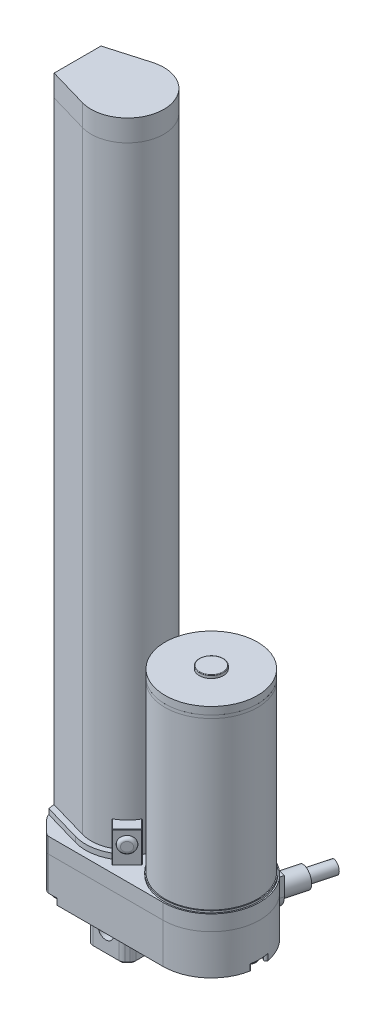
from build123d import *

# Parameters (mm, degrees)
BOSS_EXTRUDE1_DEPTH      = 6.35
SKETCH6_R                = 19.431
BOSS_EXTRUDE4_DEPTH      = 0.762
SKETCH7_R                = 19.05
BOSS_EXTRUDE5_DEPTH      = 68.326
FILLET6_R                = 5.08
FILLET7_R                = 1.905
BOSS_EXTRUDE15_DEPTH     = 6.35
SKETCH24_R               = 4.064
BOSS_EXTRUDE16_DEPTH     = 10.16
SKETCH25_R               = 2.54
BOSS_EXTRUDE17_DEPTH     = 10.16
BOSS_EXTRUDE19_DEPTH     = 16.51
FILLET13_R               = 1.905
FILLET14_R               = 5.08
BOSS_EXTRUDE20_DEPTH     = 18.796
CHAMFER1_SIZE            = 2.54
FILLET15_R               = 2.54
CHAMFER2_SIZE            = 0.762
SKETCH27_R               = 3.175
CUT_EXTRUDE3_DEPTH       = 19.05
SKETCH28_R               = 19.05
BOSS_EXTRUDE22_DEPTH     = 1.27
SKETCH29_R               = 19.05
BOSS_EXTRUDE24_DEPTH     = 3.048
BOSS_EXTRUDE25_START     = 4.318
SKETCH8_R                = 4.953
BOSS_EXTRUDE25_DEPTH     = 1.27
FILLET16_R               = 0.2286
BOSS_EXTRUDE26_DEPTH     = 254.381
BOSS_EXTRUDE27_DEPTH     = 8.89
SKETCH33_R               = 9.906
BOSS_EXTRUDE28_DEPTH     = 21.336
BOSS_EXTRUDE30_DEPTH     = 2.159
BOSS_EXTRUDE31_DEPTH     = 2.159
BOSS_EXTRUDE33_DEPTH     = 12.7
BOSS_EXTRUDE33_2_DEPTH   = 12.7
FILLET17_R               = 0.2286
FILLET18_R               = 0.2286
SKETCH43_R               = 3.175
BOSS_EXTRUDE34_DEPTH     = 1.27
FILLET19_R               = 1.27
SKETCH44_R               = 3.175
BOSS_EXTRUDE35_DEPTH     = 1.27
FILLET20_R               = 1.27
CUT_EXTRUDE5_START       = -2.54
CUT_EXTRUDE5_DEPTH       = 2.54
CUT_EXTRUDE6_START       = -2.54
CUT_EXTRUDE6_DEPTH       = 2.54
SKETCH47_R               = 2.54
BOSS_EXTRUDE36_DEPTH     = 2.54
BOSS_EXTRUDE36_2_DEPTH   = 2.54
BOSS_EXTRUDE36_3_DEPTH   = 2.54
FILLET22_R               = 1.524
FILLET23_R               = 1.524
SKETCH48_R               = 3.81
BOSS_EXTRUDE37_DEPTH     = 1.524
FILLET24_R               = 1.524
FILLET25_R               = 1.524
SKETCH49_R               = 3.81
CUT_EXTRUDE7_DEPTH       = 2.54
SKETCH50_R               = 3.556
BOSS_EXTRUDE39_DEPTH     = 2.54
CUT_EXTRUDE11_DEPTH      = 305.554552522
CUT_EXTRUDE11_DEPTH_BACK = 305.554552522
SKETCH52_R               = 3.175
SKETCH54_R               = 9.906
CUT_EXTRUDE12_DEPTH      = 21.336


with BuildPart() as part:
    # Sketch1 → Boss-Extrude1 (new body)
    with BuildSketch(Plane(origin=(0, 0, 0), x_dir=(1, 0, 0), z_dir=(0, 1, 0))):
        with BuildLine():
            Line((0, 32.639), (7.239, 39.878))
            Line((7.239, 39.878), (55.118, 39.878))
            ThreePointArc((55.118, 39.878), (75.057, 19.939), (55.118, 0))
            Line((55.118, 0), (7.239, 0))
            Line((7.239, 0), (0, 7.239))
            Line((0, 7.239), (0, 32.639))
        make_face()
    extrude(amount=BOSS_EXTRUDE1_DEPTH)

    # Fillet6
    fillet6_edges = [part.edges().sort_by_distance(p)[0] for p in [
        (0, 3.175, -7.239),
        (0, 3.175, -32.639),
    ]]
    fillet(fillet6_edges, radius=FILLET6_R)

    # Fillet7
    fillet7_edges = [part.edges().sort_by_distance(p)[0] for p in [
        (7.239, 3.175, 0),
        (7.239, 3.175, -39.878),
    ]]
    fillet(fillet7_edges, radius=FILLET7_R)


with BuildPart() as body_2:
    # Sketch6 → Boss-Extrude4 (new body)
    with BuildSketch(Plane(origin=(0, 6.35, 0), x_dir=(1, 0, 0), z_dir=(0, 1, 0))):
        with Locations(Location((55.118, 19.939, 0), (0, 0, 90))):
            Circle(SKETCH6_R)
    extrude(amount=BOSS_EXTRUDE4_DEPTH)


with BuildPart() as body_3:
    # Sketch7 → Boss-Extrude5 (new body)
    with BuildSketch(Plane(origin=(0, 7.112, 0), x_dir=(1, 0, 0), z_dir=(0, 1, 0))):
        with Locations(Location((55.118, 19.939, 0), (0, 0, 270))):
            Circle(SKETCH7_R)
    extrude(amount=BOSS_EXTRUDE5_DEPTH)


with BuildPart() as body_4:
    # Sketch23 → Boss-Extrude15 (new body)
    with BuildSketch(Plane(origin=(12.522748088, 0, -46.735532116), x_dir=(0, -1, 0), z_dir=(0.25881904510252135, 0, -0.9659258262890681))):
        with BuildLine():
            Line((-2.032, -53.883866243), (5.588, -53.883866243))
            ThreePointArc((5.588, -53.883866243), (11.303, -48.168866243), (5.588, -42.453866243))
            Line((5.588, -42.453866243), (-2.032, -42.453866243))
            Line((-2.032, -42.453866243), (-2.032, -53.883866243))
        make_face()
    extrude(amount=BOSS_EXTRUDE15_DEPTH)

    # Sketch24 → Boss-Extrude16 (add)
    with BuildSketch(Plane(origin=(14.166249025, 0, -52.869161113), x_dir=(-0.9659258262890682, 0, -0.25881904510252135), z_dir=(0.2588190451025213, 0, -0.9659258262890681))):
        with Locations((-48.168866243, -5.588)):
            Circle(SKETCH24_R)
    extrude(amount=BOSS_EXTRUDE16_DEPTH)

    # Sketch25 → Boss-Extrude17 (add)
    with BuildSketch(Plane(origin=(16.795850523, 0, -62.682967508), x_dir=(-0.9659258262890681, 0, -0.25881904510252135), z_dir=(0.25881904510252135, 0, -0.9659258262890681))):
        with Locations((-48.168866243, -5.588)):
            Circle(SKETCH25_R)
    extrude(amount=BOSS_EXTRUDE17_DEPTH)


with BuildPart() as body_5:
    # Sketch1<3> → Boss-Extrude19 (new body)
    with BuildSketch(Plane(origin=(0, 0, 0), x_dir=(1, 0, 0), z_dir=(0, 1, 0))):
        with BuildLine():
            Line((0, 32.639), (7.239, 39.878))
            Line((7.239, 39.878), (55.118, 39.878))
            ThreePointArc((55.118, 39.878), (75.057, 19.939), (55.118, 0))
            Line((55.118, 0), (7.239, 0))
            Line((7.239, 0), (0, 7.239))
            Line((0, 7.239), (0, 32.639))
        make_face()
    extrude(amount=-BOSS_EXTRUDE19_DEPTH)

    # Fillet13
    fillet13_edges = [body_5.edges().sort_by_distance(p)[0] for p in [
        (7.239, -8.255, 0),
        (7.239, -8.255, -39.878),
    ]]
    fillet(fillet13_edges, radius=FILLET13_R)

    # Fillet14
    fillet14_edges = [body_5.edges().sort_by_distance(p)[0] for p in [
        (0, -8.255, -7.239),
        (0, -8.255, -32.639),
    ]]
    fillet(fillet14_edges, radius=FILLET14_R)

    # Sketch45 → Cut-Extrude5 (cut)
    with BuildSketch(Plane.XZ.offset(16.51).offset(CUT_EXTRUDE5_START)):
        with BuildLine():
            ThreePointArc((5.044290367, -35.978344089), (4.718699387, -36.549691761), (4.084467985, -36.723467985))
            Line((4.084467985, -36.723467985), (6.681038418, -39.320038418))
            ThreePointArc((6.681038418, -39.320038418), (7.299064898, -39.732990509), (8.028076836, -39.878))
            Line((8.028076836, -39.878), (11.393838428, -39.878))
            ThreePointArc((11.393838428, -39.878), (11.138454644, -39.419455597), (11.282110896, -38.914632134))
            ThreePointArc((11.282110896, -38.914632134), (10.476958507, -32.531164357), (5.044290367, -35.978344089))
        make_face()
        with BuildLine():
            ThreePointArc((11.282110896, -0.963367866), (11.138454644, -0.458544403), (11.393838428, 0))
            Line((11.393838428, 0), (8.028076836, 0))
            ThreePointArc((8.028076836, 0), (7.299064898, -0.145009491), (6.681038418, -0.557961582))
            Line((6.681038418, -0.557961582), (4.084467985, -3.154532015))
            ThreePointArc((4.084467985, -3.154532015), (4.718699387, -3.328308239), (5.044290367, -3.899655911))
            ThreePointArc((5.044290367, -3.899655911), (10.476958507, -7.346835643), (11.282110896, -0.963367866))
        make_face()
    extrude(amount=CUT_EXTRUDE5_DEPTH, mode=Mode.SUBTRACT)

    # Sketch45<3> → Cut-Extrude6 (cut)
    with BuildSketch(Plane.XZ.offset(16.51).offset(CUT_EXTRUDE6_START)):
        with BuildLine():
            Line((4.084467985, -36.723467985), (6.681038418, -39.320038418))
            ThreePointArc((6.681038418, -39.320038418), (7.299064898, -39.732990509), (8.028076836, -39.878))
            Line((8.028076836, -39.878), (11.393838428, -39.878))
            ThreePointArc((11.393838428, -39.878), (11.138454644, -39.419455597), (11.282110896, -38.914632134))
            ThreePointArc((11.282110896, -38.914632134), (10.476958507, -32.531164357), (5.044290367, -35.978344089))
            ThreePointArc((5.044290367, -35.978344089), (4.718699387, -36.549691761), (4.084467985, -36.723467985))
        make_face()
        with BuildLine():
            Line((11.393838428, 0), (8.028076836, 0))
            ThreePointArc((8.028076836, 0), (7.299064898, -0.145009491), (6.681038418, -0.557961582))
            Line((6.681038418, -0.557961582), (4.084467985, -3.154532015))
            ThreePointArc((4.084467985, -3.154532015), (4.718699387, -3.328308239), (5.044290367, -3.899655911))
            ThreePointArc((5.044290367, -3.899655911), (10.476958507, -7.346835643), (11.282110896, -0.963367866))
            ThreePointArc((11.282110896, -0.963367866), (11.138454644, -0.458544403), (11.393838428, 0))
        make_face()
        with BuildLine():
            ThreePointArc((73.662109712, -16.992248385), (67.437, -19.939), (73.662109712, -22.885751615))
            ThreePointArc((73.662109712, -22.885751615), (74.341584064, -23.041280193), (74.712069674, -23.631716426))
            ThreePointArc((74.712069674, -23.631716426), (75.057, -19.939), (74.712069674, -16.246283574))
            ThreePointArc((74.712069674, -16.246283574), (74.341584064, -16.836719807), (73.662109712, -16.992248385))
        make_face()
    extrude(amount=CUT_EXTRUDE6_DEPTH, mode=Mode.SUBTRACT)


with BuildPart() as body_6:
    # Sketch26 → Boss-Extrude20 (new body)
    with BuildSketch(Plane(origin=(0, -16.51, 0), x_dir=(-1, 0, 0), z_dir=(0, -1, 0))):
        Polygon((-20.574, 28.829), (-11.684, 28.829), (-11.684, 11.049), (-29.464, 11.049), (-29.464, 28.829), align=None)
    extrude(amount=BOSS_EXTRUDE20_DEPTH)

    # Chamfer1
    chamfer1_edges = [body_6.edges().sort_by_distance(p)[0] for p in [
        (11.684, -25.908, -11.049),
        (29.464, -25.908, -11.049),
        (29.464, -25.908, -28.829),
        (11.684, -25.908, -28.829),
    ]]
    chamfer(chamfer1_edges, length=CHAMFER1_SIZE)

    # Fillet15
    fillet15_edges = [body_6.edges().sort_by_distance(p)[0] for p in [
        (29.464, -25.908, -13.589),
        (29.464, -25.908, -26.289),
        (14.224, -25.908, -28.829),
        (26.924, -25.908, -28.829),
        (14.224, -25.908, -11.049),
        (26.924, -25.908, -11.049),
        (11.684, -25.908, -26.289),
        (11.684, -25.908, -13.589),
    ]]
    fillet(fillet15_edges, radius=FILLET15_R)

    # Chamfer2
    chamfer2_edges = [body_6.edges().sort_by_distance(p)[0] for p in [
        (11.684, -35.306, -19.939),
        (12.954, -35.306, -12.319),
        (20.574, -35.306, -28.829),
        (28.194, -35.306, -27.559),
        (29.464, -35.306, -19.939),
        (28.194, -35.306, -12.319),
        (20.574, -35.306, -11.049),
        (12.954, -35.306, -27.559),
        (14.30408653, -35.306, -28.635654013),
        (11.877345987, -35.306, -26.20891347),
        (26.84391347, -35.306, -28.635654013),
        (29.270654013, -35.306, -26.20891347),
        (29.270654013, -35.306, -13.66908653),
        (26.84391347, -35.306, -11.242345987),
        (14.30408653, -35.306, -11.242345987),
        (11.877345987, -35.306, -13.66908653),
    ]]
    chamfer(chamfer2_edges, length=CHAMFER2_SIZE)

    # Sketch27 → Cut-Extrude3 (cut)
    with BuildSketch(Plane.XY.offset(-11.049)):
        with Locations((20.574, -26.67)):
            Circle(SKETCH27_R)
    extrude(amount=-CUT_EXTRUDE3_DEPTH, mode=Mode.SUBTRACT)


with BuildPart() as body_7:
    # Sketch28 → Boss-Extrude22 (new body)
    with BuildSketch(Plane(origin=(0, 75.438, 0), x_dir=(1, 0, 0), z_dir=(0, 1, 0))):
        with Locations(Location((55.118, 19.939, 0), (0, 0, 270))):
            Circle(SKETCH28_R)
    extrude(amount=BOSS_EXTRUDE22_DEPTH)


with BuildPart() as body_8:
    # Sketch29 → Boss-Extrude24 (new body)
    with BuildSketch(Plane(origin=(0, 76.708, 0), x_dir=(1, 0, 0), z_dir=(0, 1, 0))):
        with Locations(Location((55.118, 19.939, 0), (0, 0, 90))):
            Circle(SKETCH29_R)
    extrude(amount=BOSS_EXTRUDE24_DEPTH)

    # Sketch8 → Boss-Extrude25 (add)
    with BuildSketch(Plane(origin=(0, 75.438, 0), x_dir=(1, 0, 0), z_dir=(0, 1, 0)).offset(BOSS_EXTRUDE25_START)):
        with Locations(Location((55.118, 19.939, 0), (0, 0, 270))):
            Circle(SKETCH8_R)
    extrude(amount=BOSS_EXTRUDE25_DEPTH)

    # Fillet16
    fillet16_edges = [body_8.edges().sort_by_distance(p)[0] for p in [
        (55.118, 81.026, -24.892),
    ]]
    fillet(fillet16_edges, radius=FILLET16_R)


with BuildPart() as body_9:
    # Sketch15 → Boss-Extrude26 (new body)
    with BuildSketch(Plane(origin=(0, 6.35, 0), x_dir=(1, 0, 0), z_dir=(0, 1, 0))):
        with BuildLine():
            Line((0, 19.939), (0, 10.286870396))
            Line((0, 10.286870396), (16.411980417, 5.54225678))
            ThreePointArc((16.411980417, 5.54225678), (35.560281138, 19.939054609), (16.411875495, 34.335712887))
            Line((16.411875495, 34.335712887), (0, 29.591))
            Line((0, 29.591), (0, 19.939))
        make_face()
    extrude(amount=BOSS_EXTRUDE26_DEPTH)

    # Sketch48 → Boss-Extrude37 (add)
    with BuildSketch(Plane.ZY):
        with Locations(Location((-19.939, 12.7, 0), (0, 0, 180))):
            Circle(SKETCH48_R)
    extrude(amount=BOSS_EXTRUDE37_DEPTH)

    # Fillet24
    fillet24_edges = [body_9.edges().sort_by_distance(p)[0] for p in [
        (-1.524, 12.7, -16.129),
    ]]
    fillet(fillet24_edges, radius=FILLET24_R - 0.0001)  # a hair under: the kernel refuses the full size

    # Sketch49 → Cut-Extrude7 (cut)
    with BuildSketch(Plane.ZY):
        with Locations((-19.938935198, 255.778)):
            Circle(SKETCH49_R)
    extrude(amount=-CUT_EXTRUDE7_DEPTH, mode=Mode.SUBTRACT)

    # Sketch50 → Boss-Extrude39 (add)
    with BuildSketch(Plane.ZY.offset(-2.54)):
        with Locations((-19.938935198, 255.778)):
            Circle(SKETCH50_R)
    extrude(amount=BOSS_EXTRUDE39_DEPTH)


with BuildPart() as body_10:
    # Sketch32 → Boss-Extrude27 (new body)
    with BuildSketch(Plane(origin=(0, 260.731, 0), x_dir=(1, 0, 0), z_dir=(0, 1, 0))):
        with BuildLine():
            Line((0, 10.286870396), (0, 29.591))
            Line((0, 29.591), (16.411875495, 34.335712887))
            ThreePointArc((16.411875495, 34.335712887), (35.560281138, 19.939054609), (16.411980417, 5.54225678))
            Line((16.411980417, 5.54225678), (0, 10.286870396))
        make_face()
    extrude(amount=BOSS_EXTRUDE27_DEPTH)

    # Sketch33 → Boss-Extrude28 (add)
    with BuildSketch(Plane(origin=(0, 269.621, 0), x_dir=(1, 0, 0), z_dir=(0, 1, 0))):
        with Locations(Location((20.574, 19.939, 0), (0, 0, 270))):
            Circle(SKETCH33_R)
    extrude(amount=BOSS_EXTRUDE28_DEPTH)

    # Sketch52 → Cut-Extrude11 (cut, two sides: drawn at the far end of the back side and taken through both)
    with BuildSketch(Plane.XY.offset(-11.049).offset(-CUT_EXTRUDE11_DEPTH_BACK)):
        with Locations(Location((20.574, 281.432, 0), (0, 0, 89.99999999))):
            Circle(SKETCH52_R)
    extrude(amount=CUT_EXTRUDE11_DEPTH + CUT_EXTRUDE11_DEPTH_BACK, mode=Mode.SUBTRACT)

    # Sketch54 → Cut-Extrude12 (cut)
    with BuildSketch(Plane(origin=(0, 290.957, 0), x_dir=(1, 0, 0), z_dir=(0, 1, 0))):
        with Locations((20.574, 19.939)):
            Circle(SKETCH54_R)
    extrude(amount=-CUT_EXTRUDE12_DEPTH, mode=Mode.SUBTRACT)


with BuildPart() as body_11:
    # Sketch41 → Boss-Extrude30 (new body)
    with BuildSketch(Plane(origin=(0, 6.35, 0), x_dir=(1, 0, 0), z_dir=(0, 1, 0))):
        with BuildLine():
            Line((0, 29.591), (16.411875495, 34.335712887))
            ThreePointArc((16.411875495, 34.335712887), (22.021175201, 34.855243035), (27.425990452, 33.267122493))
            Line((27.425990452, 33.267122493), (29.11221422, 34.953346261))
            ThreePointArc((29.11221422, 34.953346261), (22.604273469, 37.091541659), (15.776987058, 36.531780434))
            Line((15.776987058, 36.531780434), (0.2736806, 32.049737053))
            Line((0.2736806, 32.049737053), (0, 30.534795103))
            Line((0, 30.534795103), (0, 29.591))
        make_face()
    extrude(amount=BOSS_EXTRUDE30_DEPTH)


with BuildPart() as body_12:
    # Sketch41<11> → Boss-Extrude31 (new body)
    with BuildSketch(Plane(origin=(0, 6.35, 0), x_dir=(1, 0, 0), z_dir=(0, 1, 0))):
        with BuildLine():
            Line((16.411875495, 5.542157508), (0, 10.286870396))
            Line((0, 10.286870396), (0, 9.343204897))
            Line((0, 9.343204897), (0, 9.343075292))
            Line((0, 9.343075292), (0.2736806, 7.828133343))
            Line((0.2736806, 7.828133343), (15.776987058, 3.346089961))
            ThreePointArc((15.776987058, 3.346089961), (22.604273469, 2.786328737), (29.11221422, 4.924524135))
            Line((29.11221422, 4.924524135), (27.425990452, 6.610747903))
            ThreePointArc((27.425990452, 6.610747903), (22.021175201, 5.02262736), (16.411875495, 5.542157508))
        make_face()
    extrude(amount=BOSS_EXTRUDE31_DEPTH)


with BuildPart() as body_13:
    # Sketch41<12> → Boss-Extrude33 (new body)
    with BuildSketch(Plane(origin=(0, 6.35, 0), x_dir=(1, 0, 0), z_dir=(0, 1, 0))):
        with BuildLine():
            Line((29.11221422, 34.953346261), (27.425990452, 33.267122493))
            ThreePointArc((27.425990452, 33.267122493), (31.070982239, 30.634886416), (33.77116823, 27.039941701))
            Line((33.77116823, 27.039941701), (37.542875801, 30.811649272))
            Line((37.542875801, 30.811649272), (31.256696516, 37.097828557))
            Line((31.256696516, 37.097828557), (29.11221422, 34.953346261))
        make_face()
    extrude(amount=BOSS_EXTRUDE33_DEPTH)

    # Fillet17
    fillet17_edges = [body_13.edges().sort_by_distance(p)[0] for p in [
        (35.657022016, 19.05, -28.925795487),
        (34.399786159, 19.05, -33.954738915),
        (29.341343484, 19.05, -35.182475525),
        (31.256696516, 12.7, -37.097828557),
        (37.542875801, 12.7, -30.811649272),
    ]]
    fillet(fillet17_edges, radius=FILLET17_R)


with BuildPart() as body_14:
    # Sketch41<12> → Boss-Extrude33 2 (new body)
    with BuildSketch(Plane(origin=(0, 6.35, 0), x_dir=(1, 0, 0), z_dir=(0, 1, 0))):
        with BuildLine():
            Line((31.256696516, 2.780041839), (37.542875801, 9.066221123))
            Line((37.542875801, 9.066221123), (33.77116823, 12.837928694))
            ThreePointArc((33.77116823, 12.837928694), (31.070982239, 9.24298398), (27.425990452, 6.610747903))
            Line((27.425990452, 6.610747903), (29.11221422, 4.924524135))
            Line((29.11221422, 4.924524135), (31.256696516, 2.780041839))
        make_face()
    extrude(amount=BOSS_EXTRUDE33_2_DEPTH)

    # Fillet18
    fillet18_edges = [body_14.edges().sort_by_distance(p)[0] for p in [
        (34.399786159, 19.05, -5.923131481),
        (35.657022016, 19.05, -10.952074909),
        (29.341343484, 19.05, -4.695394871),
        (37.542875801, 12.7, -9.066221123),
        (31.256696516, 12.7, -2.780041839),
    ]]
    fillet(fillet18_edges, radius=FILLET18_R)


with BuildPart() as body_15:
    # Sketch43 → Boss-Extrude34 (new body)
    with BuildSketch(Plane(origin=(34.177262537, 0, -34.177262537), x_dir=(-0.7071067811865481, 0, -0.7071067811865469), z_dir=(0.7071067811865469, 0, -0.7071067811865481))):
        with Locations(Location((-0.314695924, 13.7414, 0), (0, 0, 180))):
            Circle(SKETCH43_R)
    extrude(amount=BOSS_EXTRUDE34_DEPTH)

    # Fillet19
    fillet19_edges = [body_15.edges().sort_by_distance(p)[0] for p in [
        (33.052747741, 13.7414, -37.097828557),
    ]]
    fillet(fillet19_edges, radius=FILLET19_R - 0.0001)  # a hair under: the kernel refuses the full size


with BuildPart() as body_16:
    # Sketch44 → Boss-Extrude35 (new body)
    with BuildSketch(Plane(origin=(14.238327339, 0, 14.238327339), x_dir=(0.7071067811865481, 0, -0.7071067811865469), z_dir=(0.7071067811865469, 0, 0.7071067811865481))):
        with Locations(Location((28.5126085, 13.7414, 0), (0, 0, 180))):
            Circle(SKETCH44_R)
    extrude(amount=BOSS_EXTRUDE35_DEPTH)

    # Fillet20
    fillet20_edges = [body_16.edges().sort_by_distance(p)[0] for p in [
        (37.542875801, 13.7414, -7.270169899),
    ]]
    fillet(fillet20_edges, radius=FILLET20_R - 0.0001)  # a hair under: the kernel refuses the full size


with BuildPart() as body_17:
    # Sketch47 → Boss-Extrude36 (new body)
    with BuildSketch(Plane(origin=(0, -13.97, 0), x_dir=(-1, 0, 0), z_dir=(0, -1, 0))):
        with Locations(Location((-8.854290367, 35.978344089, 0), (0, 0, 90))):
            Circle(SKETCH47_R)
    extrude(amount=BOSS_EXTRUDE36_DEPTH)

    # Fillet22
    fillet22_edges = [body_17.edges().sort_by_distance(p)[0] for p in [
        (8.854290367, -16.51, -33.438344089),
    ]]
    fillet(fillet22_edges, radius=FILLET22_R)


with BuildPart() as body_18:
    # Sketch47 → Boss-Extrude36 2 (new body)
    with BuildSketch(Plane(origin=(0, -13.97, 0), x_dir=(-1, 0, 0), z_dir=(0, -1, 0))):
        with Locations(Location((-8.854290367, 3.899655911, 0), (0, 0, 90))):
            Circle(SKETCH47_R)
    extrude(amount=BOSS_EXTRUDE36_2_DEPTH)

    # Fillet23
    fillet23_edges = [body_18.edges().sort_by_distance(p)[0] for p in [
        (8.854290367, -16.51, -1.359655911),
    ]]
    fillet(fillet23_edges, radius=FILLET23_R)


with BuildPart() as body_19:
    # Sketch47 → Boss-Extrude36 3 (new body)
    with BuildSketch(Plane(origin=(0, -13.97, 0), x_dir=(-1, 0, 0), z_dir=(0, -1, 0))):
        with Locations(Location((-71.247, 19.939, 0), (0, 0, 90))):
            Circle(SKETCH47_R)
    extrude(amount=BOSS_EXTRUDE36_3_DEPTH)

    # Fillet25
    fillet25_edges = [body_19.edges().sort_by_distance(p)[0] for p in [
        (71.247, -16.51, -17.399),
    ]]
    fillet(fillet25_edges, radius=FILLET25_R)


solid = Compound([part.part, body_2.part, body_3.part, body_4.part, body_5.part, body_6.part, body_7.part, body_8.part, body_9.part, body_10.part, body_11.part, body_12.part, body_13.part, body_14.part, body_15.part, body_16.part, body_17.part, body_18.part, body_19.part])
